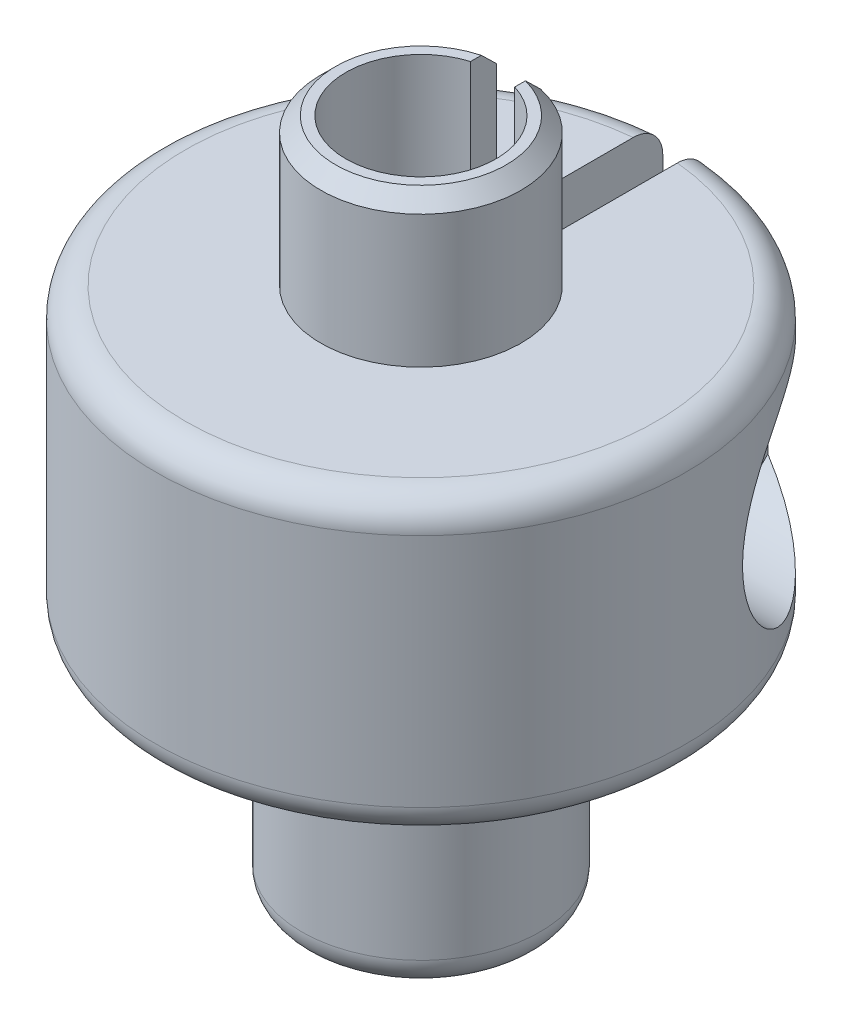
from build123d import *

# Parameters (mm, degrees)
SKETCH1_R            = 4.05
BOSS_EXTRUDE1_DEPTH  = 8
SKETCH2_R            = 9
BOSS_EXTRUDE2_DEPTH  = 10
FILLET1_R            = 1
SKETCH3_R            = 2.55
CUT_EXTRUDE1_DEPTH   = 10
CUT_EXTRUDE2_REACH   = 24.045
M3_CLEARANCE_HOLE1_D = 3.4
SKETCH28_R           = 3.5
CUT_EXTRUDE3_DEPTH   = 6.5
SKETCH29_W           = 8.1
SKETCH29_H           = 0.5
CUT_EXTRUDE7_DEPTH   = 23.045407848
FILLET2_R            = 0.25
BOSS_EXTRUDE3_START  = 5
BOSS_EXTRUDE3_DEPTH  = 5
CHAMFER1_SIZE        = 0.5


with BuildPart() as part:
    # Sketch1 → Boss-Extrude1 (new body)
    with BuildSketch(Plane(origin=(0, 0, 0), x_dir=(1, 0, 0), z_dir=(0, 1, 0))):
        with Locations(Location((0, 0, 0), (0, 0, 270))):
            Circle(SKETCH1_R)
    extrude(amount=BOSS_EXTRUDE1_DEPTH)

    # Sketch2 → Boss-Extrude2 (add)
    with BuildSketch(Plane(origin=(0, 8, 0), x_dir=(1, 0, 0), z_dir=(0, 1, 0))):
        with Locations(Location((0, 0, 0), (0, 0, 270))):
            Circle(SKETCH2_R)
    extrude(amount=BOSS_EXTRUDE2_DEPTH)

    # Fillet1
    fillet1_edges = [part.edges().sort_by_distance(p)[0] for p in [
        (0, 0, -4.05),
        (0, 8, -9),
        (0, 18, -9),
    ]]
    fillet(fillet1_edges, radius=FILLET1_R)

    # Sketch3 → Cut-Extrude1 (cut)
    with BuildSketch(Plane(origin=(0, 18, 0), x_dir=(1, 0, 0), z_dir=(0, 1, 0))):
        with Locations(Location((0, 0, 0), (0, 0, 270))):
            Circle(SKETCH3_R)
    extrude(amount=-CUT_EXTRUDE1_DEPTH, mode=Mode.SUBTRACT)

    # Cut-Extrude2: up to this face of the body (flat: up to its plane)
    cut_extrude2_end = Plane(part.part.faces().sort_by_distance((0, 8, -7.77372583))[0])
    # Sketch20 → Cut-Extrude2 (cut, up to the picked face)
    with BuildSketch(Plane(origin=(0, 18, 0), x_dir=(1, 0, 0), z_dir=(0, 1, 0)), mode=Mode.PRIVATE) as cut_extrude2_sk1:
        with BuildLine():
            Line((-0.75, 2.437211521), (0.75, 2.437211521))
            Line((0.75, 2.437211521), (0.75, 8.968695557))
            ThreePointArc((0.75, 8.968695557), (0, 9), (-0.75, 8.968695557))
            Line((-0.75, 8.968695557), (-0.75, 2.437211521))
        make_face()
    cut_extrude2_tool1 = split(extrude(cut_extrude2_sk1.sketch, amount=-CUT_EXTRUDE2_REACH, mode=Mode.PRIVATE), bisect_by=cut_extrude2_end, keep=Keep.BOTH, mode=Mode.PRIVATE)
    add(cut_extrude2_tool1.solids().sort_by(Axis((0, 18, -5.713399), (0, -1, 0)))[0], mode=Mode.SUBTRACT)

    # M3 Clearance Hole1 (through all)
    with Locations(Plane(origin=(10, 0, 0), x_dir=(0, 0, -1), z_dir=(1, 0, 0))):
        with Locations((5.702953539, 13)):
            Hole(M3_CLEARANCE_HOLE1_D / 2)

    # Sketch28 → Cut-Extrude3 (cut)
    with BuildSketch(Plane(origin=(10, 0, 0), x_dir=(0, 0, -1), z_dir=(1, 0, 0))):
        with Locations((5.702953539, 13)):
            Circle(SKETCH28_R)
    cut_extrude3 = extrude(amount=-CUT_EXTRUDE3_DEPTH, mode=Mode.SUBTRACT)

    # Mirror1: Cut-Extrude3 across plane
    add(cut_extrude3.mirror(Plane(origin=(0, 0, 0), x_dir=(0, 0, 1), z_dir=(1, 0, 0))), mode=Mode.SUBTRACT)

    # Sketch29 → Cut-Extrude7 (cut, through all)
    with BuildSketch(Plane.XY):
        with Locations((0, 7.75)):
            Rectangle(SKETCH29_W, SKETCH29_H)
    extrude(amount=-CUT_EXTRUDE7_DEPTH, mode=Mode.SUBTRACT)

    # Fillet2
    fillet2_edges = [part.edges().sort_by_distance(p)[0] for p in [
        (-3.3, 8, 0),
        (3.3, 8, 0),
        (0, 7.5, 0),
    ]]
    fillet(fillet2_edges, radius=FILLET2_R - 0.0001)  # a hair under: the kernel refuses the full size

    # Sketch30 → Boss-Extrude3 (add)
    with BuildSketch(Plane(origin=(0, 18, 0), x_dir=(1, 0, 0), z_dir=(0, 1, 0)).offset(BOSS_EXTRUDE3_START)):
        with BuildLine():
            Line((-0.75, 3.31624788), (-0.75, 2.437211521))
            ThreePointArc((-0.75, 2.437211521), (0, -2.55), (0.75, 2.437211521))
            Line((0.75, 2.437211521), (0.75, 3.31624788))
            ThreePointArc((0.75, 3.31624788), (0, -3.4), (-0.75, 3.31624788))
        make_face()
    extrude(amount=-BOSS_EXTRUDE3_DEPTH)

    # Chamfer1
    chamfer1_edges = [part.edges().sort_by_distance(p)[0] for p in [
        (0, 23, 3.4),
    ]]
    chamfer(chamfer1_edges, length=CHAMFER1_SIZE)


solid = part.part
